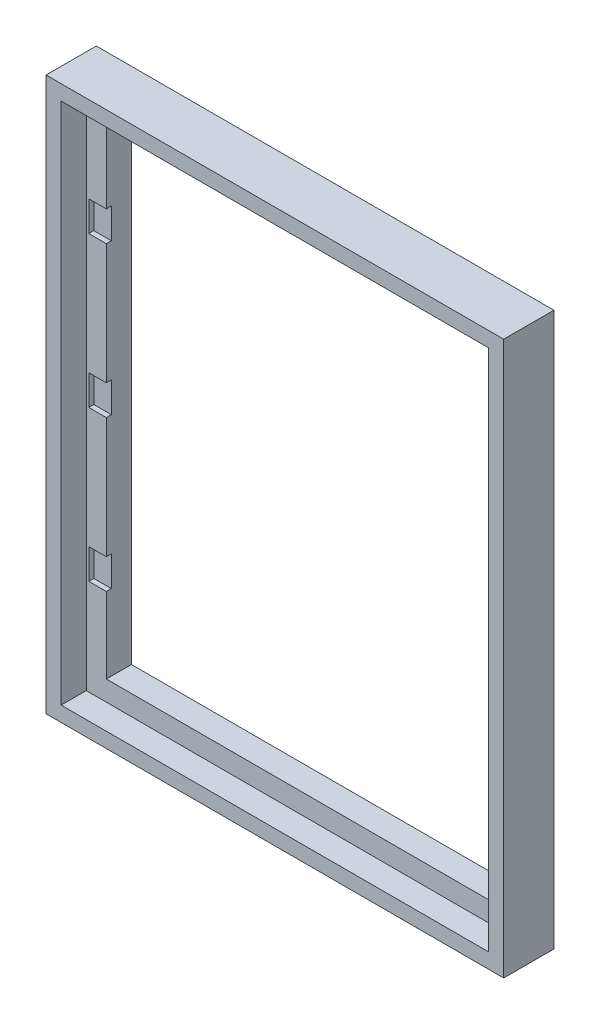
from build123d import *

# Parameters (mm, degrees)
MODEL_W             = 85.14935
MODEL_H             = 104.19946
MODEL_W_2           = 77.14935
MODEL_H_2           = 96.19946
EXTRUDE_2_DEPTH     = 5
SKETCH_2_W          = 3.5
SKETCH_2_H          = 6
CUT_EXTRUDE_1_DEPTH = 1
SKETCH_4_W          = 91.14935
SKETCH_4_H          = 110.19946
SKETCH_4_W_2        = 85.14935
SKETCH_4_H_2        = 104.19946
EXTRUDE_5_DEPTH     = 10


with BuildPart() as part:
    # Model → 凸台-拉伸2 (new body)
    with BuildSketch(Plane.XY):
        with Locations((38.194325, 47.88337)):
            Rectangle(MODEL_W, MODEL_H)
        with Locations((38.194325, 47.88337)):
            Rectangle(MODEL_W_2, MODEL_H_2, mode=Mode.SUBTRACT)
    extrude(amount=EXTRUDE_2_DEPTH)

    # 草图2 → 切除-拉伸1 (cut)
    with BuildSketch(Plane.XY.offset(5)):
        with Locations((-2.13035, 77.88337)):
            Rectangle(SKETCH_2_W, SKETCH_2_H)
        with Locations((78.519, 77.88337)):
            Rectangle(SKETCH_2_W, SKETCH_2_H)
        with Locations((-2.13035, 47.88337)):
            Rectangle(SKETCH_2_W, SKETCH_2_H)
        with Locations((78.519, 47.88337)):
            Rectangle(SKETCH_2_W, SKETCH_2_H)
        with Locations((-2.13035, 17.88337)):
            Rectangle(SKETCH_2_W, SKETCH_2_H)
        with Locations((78.519, 17.88337)):
            Rectangle(SKETCH_2_W, SKETCH_2_H)
    extrude(amount=-CUT_EXTRUDE_1_DEPTH, mode=Mode.SUBTRACT)

    # 草图4 → 凸台-拉伸5 (add)
    with BuildSketch(Plane(origin=(0, 0, 0), x_dir=(-1, 0, 0), z_dir=(0, 0, -1))):
        with Locations((-38.194325, 47.88337)):
            Rectangle(SKETCH_4_W, SKETCH_4_H)
        with Locations((-38.194325, 47.88337)):
            Rectangle(SKETCH_4_W_2, SKETCH_4_H_2, mode=Mode.SUBTRACT)
    extrude(amount=-EXTRUDE_5_DEPTH)


solid = part.part
